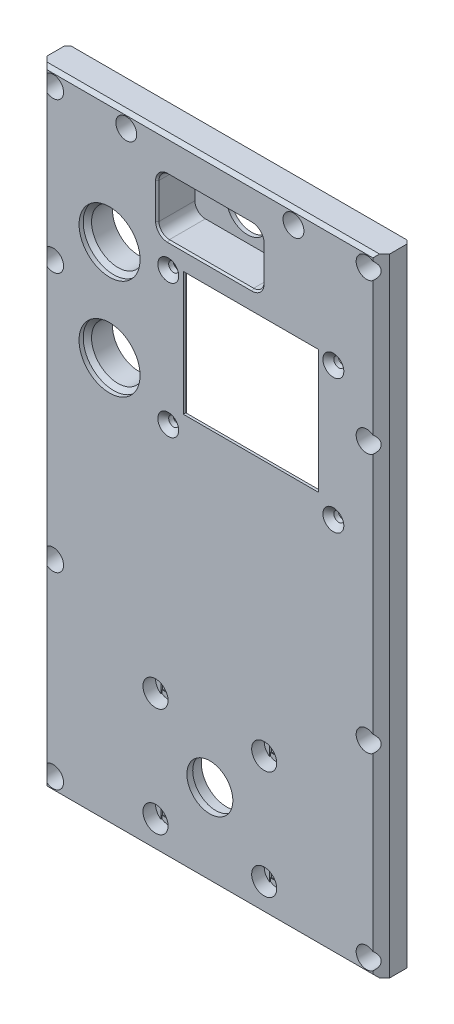
from build123d import *

# Parameters (mm, degrees)
SKETCH1_W                       = 82
SKETCH1_H                       = 150
SKETCH1_W_2                     = 68
SKETCH1_H_2                     = 136
BOSS_EXTRUDE1_DEPTH             = 7
SKETCH2_W                       = 68
SKETCH2_H                       = 36
BOSS_EXTRUDE2_DEPTH             = 7
SKETCH3_R                       = 5.5
CUT_EXTRUDE1_DEPTH              = 86.761296632
SKETCH4_R                       = 6.05
CUT_EXTRUDE2_DEPTH              = 5.6
SKETCH5_R                       = 11.1
CUT_EXTRUDE3_DEPTH              = 3
SKETCH6_R                       = 1.7
CUT_EXTRUDE4_DEPTH              = 86.761296632
SKETCH7_W                       = 50
SKETCH7_H                       = 38
CUT_EXTRUDE5_DEPTH              = 1
SKETCH8_R                       = 3
CUT_EXTRUDE6_DEPTH              = 3
SKETCH9_R                       = 1.45
CUT_EXTRUDE7_DEPTH              = 86.761296632
SKETCH10_R                      = 2.5
CUT_EXTRUDE8_DEPTH              = 5
CHAMFER1_SIZE                   = 2
SKETCH11_W                      = 68
SKETCH11_H                      = 30.5
BOSS_EXTRUDE3_DEPTH             = 7
CUT_EXTRUDE9_DEPTH              = 0.2
SKETCH13_W                      = 2.9
SKETCH13_H                      = 2.9
CUT_EXTRUDE10_DEPTH             = 0.2
CUT_EXTRUDE11_DEPTH             = 0.2
SKETCH15_W                      = 3.4
SKETCH15_H                      = 3.4
CUT_EXTRUDE12_DEPTH             = 0.2
CHAMFER3_SIZE                   = 0.8
SKETCH16_W                      = 2
SKETCH16_H                      = 4
BOSS_EXTRUDE4_DEPTH             = 1
LPATTERN1_COUNT                 = 2
LPATTERN1_PITCH                 = 20
LPATTERN1_COL_COUNT             = 2
LPATTERN1_COL_PITCH             = 20
SKETCH17_R                      = 1.45
CUT_EXTRUDE13_DEPTH             = 86.761296632
SKETCH18_R                      = 2.5
CUT_EXTRUDE14_DEPTH             = 5
CUT_EXTRUDE15_DEPTH             = 0.2
SKETCH20_W                      = 2.9
SKETCH20_H                      = 2.9
CUT_EXTRUDE16_DEPTH             = 0.2
SKIZZE4_W                       = 42
SKIZZE4_H                       = 26.8
SCHNITT_LINEAR_AUSTRAGEN1_DEPTH = 3.2
SKETCH38_W                      = 68
SKETCH38_H                      = 56
BOSS_EXTRUDE12_DEPTH            = 7
SKETCH41_W                      = 68
SKETCH41_H                      = 13.5
BOSS_EXTRUDE13_DEPTH            = 7
SKETCH44_R                      = 6.3
CUT_EXTRUDE19_DEPTH             = 86.761296632
SKETCH49_W                      = 25.15
SKETCH49_H                      = 13.5
CUT_EXTRUDE20_DEPTH             = 86.761296632
SKETCH50_W                      = 29.15
SKETCH50_H                      = 17.5
SKETCH50_W_2                    = 25.15
SKETCH50_H_2                    = 13.5
BOSS_EXTRUDE16_DEPTH            = 2
SKETCH51_W                      = 29.15
SKETCH51_H                      = 17.5
BOSS_EXTRUDE17_DEPTH            = 1
CUT_EXTRUDE21_DEPTH             = 87.058119896
CUT_EXTRUDE21_DEPTH_BACK        = 87.058119896
SKETCH52_R                      = 5
SKETCH53_W                      = 8.4
SKETCH53_H                      = 5
CUT_EXTRUDE22_DEPTH             = 6
SKETCH54_R                      = 7.3
CUT_EXTRUDE23_DEPTH             = 1
CHAMFER4_SIZE                   = 1
FILLET1_R                       = 2.5
CHAMFER5_SIZE                   = 0.4
SKETCH56_W                      = 45.7
SKETCH56_H                      = 38.2
CUT_EXTRUDE24_DEPTH             = 6.4
SKETCH57_W                      = 32.3
SKETCH57_H                      = 29.6
CUT_EXTRUDE25_DEPTH             = 86.990464588
SKETCH58_W                      = 5.1
SKETCH58_H                      = 38.2
BOSS_EXTRUDE18_DEPTH            = 1.8
SKETCH59_R                      = 1.2
CUT_EXTRUDE26_DEPTH             = 86.812353423
CHAMFER6_SIZE                   = 1.3


# Some blends are built 0.0001 mm under size
with BuildPart() as part:
    # Sketch1 → Boss-Extrude1 (new body)
    with BuildSketch(Plane.XY):
        Rectangle(SKETCH1_W, SKETCH1_H)
        Rectangle(SKETCH1_W_2, SKETCH1_H_2, mode=Mode.SUBTRACT)
    extrude(amount=BOSS_EXTRUDE1_DEPTH)

    # Sketch2 → Boss-Extrude2 (add)
    with BuildSketch(Plane.XY.offset(7)):
        with Locations((0, -50)):
            Rectangle(SKETCH2_W, SKETCH2_H)
    extrude(amount=-BOSS_EXTRUDE2_DEPTH)

    # Sketch3 → Cut-Extrude1 (cut, through all)
    with BuildSketch(Plane(origin=(0, 0, 0), x_dir=(-1, 0, 0), z_dir=(0, 0, -1))):
        with Locations((0, -55)):
            Circle(SKETCH3_R)
    extrude(amount=-CUT_EXTRUDE1_DEPTH, mode=Mode.SUBTRACT)

    # Sketch4 → Cut-Extrude2 (cut)
    with BuildSketch(Plane(origin=(0, 0, 0), x_dir=(-1, 0, 0), z_dir=(0, 0, -1))):
        with Locations((0, -55)):
            Circle(SKETCH4_R)
    extrude(amount=-CUT_EXTRUDE2_DEPTH, mode=Mode.SUBTRACT)

    # Sketch5 → Cut-Extrude3 (cut)
    with BuildSketch(Plane(origin=(0, 0, 0), x_dir=(-1, 0, 0), z_dir=(0, 0, -1))):
        with Locations((0, -55)):
            Circle(SKETCH5_R)
    extrude(amount=-CUT_EXTRUDE3_DEPTH, mode=Mode.SUBTRACT)

    # Sketch6 → Cut-Extrude4 (cut, through all)
    with BuildSketch(Plane(origin=(0, 0, 0), x_dir=(-1, 0, 0), z_dir=(0, 0, -1))):
        with Locations((-13, -42)):
            Circle(SKETCH6_R)
        with Locations((13, -42)):
            Circle(SKETCH6_R)
        with Locations((13, -68)):
            Circle(SKETCH6_R)
        with Locations((-13, -68)):
            Circle(SKETCH6_R)
    extrude(amount=-CUT_EXTRUDE4_DEPTH, mode=Mode.SUBTRACT)

    # Sketch7 → Cut-Extrude5 (cut)
    with BuildSketch(Plane(origin=(0, 0, 0), x_dir=(-1, 0, 0), z_dir=(0, 0, -1))):
        with Locations((0, -55)):
            Rectangle(SKETCH7_W, SKETCH7_H)
    extrude(amount=-CUT_EXTRUDE5_DEPTH, mode=Mode.SUBTRACT)

    # Sketch8 → Cut-Extrude6 (cut)
    with BuildSketch(Plane.XY.offset(7)):
        with Locations((-13, -42)):
            Circle(SKETCH8_R)
        with Locations((13, -42)):
            Circle(SKETCH8_R)
        with Locations((13, -68)):
            Circle(SKETCH8_R)
        with Locations((-13, -68)):
            Circle(SKETCH8_R)
    extrude(amount=-CUT_EXTRUDE6_DEPTH, mode=Mode.SUBTRACT)

    # Sketch9 → Cut-Extrude7 (cut, through all)
    with BuildSketch(Plane.XY.offset(7)):
        with Locations((-37.5, 71.5)):
            Circle(SKETCH9_R)
        with Locations((37.5, 71.5)):
            Circle(SKETCH9_R)
        with Locations((37.5, -71.5)):
            Circle(SKETCH9_R)
        with Locations((-37.5, -71.5)):
            Circle(SKETCH9_R)
        with Locations((-37.5, 35.5)):
            Circle(SKETCH9_R)
        with Locations((-37.5, -26.5)):
            Circle(SKETCH9_R)
        with Locations((37.5, -26.5)):
            Circle(SKETCH9_R)
        with Locations((37.5, 35.5)):
            Circle(SKETCH9_R)
    extrude(amount=-CUT_EXTRUDE7_DEPTH, mode=Mode.SUBTRACT)

    # Sketch10 → Cut-Extrude8 (cut)
    with BuildSketch(Plane.XY.offset(7)):
        with Locations((-37.5, 71.5)):
            Circle(SKETCH10_R)
        with Locations((37.5, 71.5)):
            Circle(SKETCH10_R)
        with Locations((-37.5, 35.5)):
            Circle(SKETCH10_R)
        with Locations((-37.5, -26.5)):
            Circle(SKETCH10_R)
        with Locations((-37.5, -71.5)):
            Circle(SKETCH10_R)
        with Locations((37.5, -71.5)):
            Circle(SKETCH10_R)
        with Locations((37.5, 35.5)):
            Circle(SKETCH10_R)
        with Locations((37.5, -26.5)):
            Circle(SKETCH10_R)
    extrude(amount=-CUT_EXTRUDE8_DEPTH, mode=Mode.SUBTRACT)

    # Chamfer1
    # the kernel refuses this chamfer: 2 mm, written as the material it takes off along each edge
    with BuildSketch(Plane(origin=(-41, 80.143365976, 7), x_dir=(-0.027495876610585623, 0, -0.9996219169112968), z_dir=(0, -1, 0)), Plane(origin=(41, -80.143365976, 7), x_dir=(0.027495876610585623, 0, -0.9996219169112968), z_dir=(0, 1, 0))) as chamfer1_piece_1:
        Polygon((CHAMFER1_SIZE * 0.999621916911, CHAMFER1_SIZE * 0.0274958766106), (-CHAMFER1_SIZE * 0.0274958766106, CHAMFER1_SIZE * 0.999621916911), (0, 0), align=None)
    extrude(amount=160.286731952, mode=Mode.SUBTRACT)

    # Sketch11 → Boss-Extrude3 (add)
    with BuildSketch(Plane.XY.offset(7)):
        with Locations((0, -16.75)):
            Rectangle(SKETCH11_W, SKETCH11_H)
    extrude(amount=-BOSS_EXTRUDE3_DEPTH)

    # Sketch12 → Cut-Extrude9 (cut)
    with BuildSketch(Plane.XY.offset(2)):
        with BuildLine():
            Line((-38.95, -73.536541185), (-38.95, -69.463458815))
            ThreePointArc((-38.95, -69.463458815), (-37.5, -69), (-36.05, -69.463458815))
            Line((-36.05, -69.463458815), (-36.05, -73.536541185))
            ThreePointArc((-36.05, -73.536541185), (-37.5, -74), (-38.95, -73.536541185))
        make_face()
        with BuildLine():
            Line((-38.95, -28.536541185), (-38.95, -24.463458815))
            ThreePointArc((-38.95, -24.463458815), (-37.5, -24), (-36.05, -24.463458815))
            Line((-36.05, -24.463458815), (-36.05, -28.536541185))
            ThreePointArc((-36.05, -28.536541185), (-37.5, -29), (-38.95, -28.536541185))
        make_face()
        with BuildLine():
            Line((-38.95, 33.463458815), (-38.95, 37.536541185))
            ThreePointArc((-38.95, 37.536541185), (-37.5, 38), (-36.05, 37.536541185))
            Line((-36.05, 37.536541185), (-36.05, 33.463458815))
            ThreePointArc((-36.05, 33.463458815), (-37.5, 33), (-38.95, 33.463458815))
        make_face()
        with BuildLine():
            Line((-38.95, 69.463458815), (-38.95, 73.536541185))
            ThreePointArc((-38.95, 73.536541185), (-37.5, 74), (-36.05, 73.536541185))
            Line((-36.05, 73.536541185), (-36.05, 69.463458815))
            ThreePointArc((-36.05, 69.463458815), (-37.5, 69), (-38.95, 69.463458815))
        make_face()
    cut_extrude9 = extrude(amount=-CUT_EXTRUDE9_DEPTH, mode=Mode.SUBTRACT)

    # Sketch13 → Cut-Extrude10 (cut)
    with BuildSketch(Plane.XY.offset(1.8)):
        with Locations((-37.5, -71.5)):
            Rectangle(SKETCH13_W, SKETCH13_H)
        with Locations((-37.5, -26.5)):
            Rectangle(SKETCH13_W, SKETCH13_H)
        with Locations((-37.5, 35.5)):
            Rectangle(SKETCH13_W, SKETCH13_H)
        with Locations((-37.5, 71.5)):
            Rectangle(SKETCH13_W, SKETCH13_H)
    cut_extrude10 = extrude(amount=-CUT_EXTRUDE10_DEPTH, mode=Mode.SUBTRACT)

    # Sketch14 → Cut-Extrude11 (cut)
    with BuildSketch(Plane.XY.offset(4)):
        with BuildLine():
            Line((-14.7, -44.471841419), (-14.7, -39.528158581))
            ThreePointArc((-14.7, -39.528158581), (-13, -39), (-11.3, -39.528158581))
            Line((-11.3, -39.528158581), (-11.3, -44.471841419))
            ThreePointArc((-11.3, -44.471841419), (-13, -45), (-14.7, -44.471841419))
        make_face()
        with BuildLine():
            Line((-14.7, -70.471841419), (-14.7, -65.528158581))
            ThreePointArc((-14.7, -65.528158581), (-13, -65), (-11.3, -65.528158581))
            Line((-11.3, -65.528158581), (-11.3, -70.471841419))
            ThreePointArc((-11.3, -70.471841419), (-13, -71), (-14.7, -70.471841419))
        make_face()
    cut_extrude11 = extrude(amount=-CUT_EXTRUDE11_DEPTH, mode=Mode.SUBTRACT)

    # Sketch15 → Cut-Extrude12 (cut)
    with BuildSketch(Plane.XY.offset(3.8)):
        with Locations((-13, -42)):
            Rectangle(SKETCH15_W, SKETCH15_H)
        with Locations((-13, -68)):
            Rectangle(SKETCH15_W, SKETCH15_H)
    cut_extrude12 = extrude(amount=-CUT_EXTRUDE12_DEPTH, mode=Mode.SUBTRACT)

    # Mirror1: Cut-Extrude9, Cut-Extrude10, Cut-Extrude11, Cut-Extrude12 across plane
    add(cut_extrude9.mirror(Plane(origin=(0, 0, 0), x_dir=(0, 0, 1), z_dir=(1, 0, 0))), mode=Mode.SUBTRACT)
    add(cut_extrude10.mirror(Plane(origin=(0, 0, 0), x_dir=(0, 0, 1), z_dir=(1, 0, 0))), mode=Mode.SUBTRACT)
    add(cut_extrude11.mirror(Plane(origin=(0, 0, 0), x_dir=(0, 0, 1), z_dir=(1, 0, 0))), mode=Mode.SUBTRACT)
    add(cut_extrude12.mirror(Plane(origin=(0, 0, 0), x_dir=(0, 0, 1), z_dir=(1, 0, 0))), mode=Mode.SUBTRACT)

    # Chamfer3
    chamfer3_edges = [part.edges().sort_by_distance(p)[0] for p in [
        (0, 75, 7),
        (0, -75, 7),
        (-41, 0, 0),
        (41, 0, 0),
    ]]
    chamfer(chamfer3_edges, length=CHAMFER3_SIZE)

    # Sketch16 → Boss-Extrude4 (add, symmetric)
    # profile 1 of 2: a face of its own
    with BuildSketch(Plane(origin=(0, 0, 0), x_dir=(0, 0, -1), z_dir=(1, 0, 0))):
        Polygon((0, -4), (0, -15.4), (3.2, -12.2), (3.2, -7.2), align=None)
        with Locations((1.6, -9.7)):
            Rectangle(SKETCH16_W, SKETCH16_H, mode=Mode.SUBTRACT)
    # profile 2 of 2: a face of its own
    with BuildSketch(Plane(origin=(0, 0, 0), x_dir=(0, 0, -1), z_dir=(1, 0, 0))):
        Polygon((3.2, -27.6), (0, -30.8), (0, -19.4), (3.2, -22.6), align=None)
        with Locations((1.6, -25.1)):
            Rectangle(SKETCH16_W, SKETCH16_H, mode=Mode.SUBTRACT)
    boss_extrude4 = extrude(amount=BOSS_EXTRUDE4_DEPTH, both=True)

    # LPattern1: Boss-Extrude4 ×2
    with Locations(*[(i * LPATTERN1_PITCH, 0, 0) for i in range(1, LPATTERN1_COUNT)]):
        add(boss_extrude4)

    # LPattern1 col: Boss-Extrude4 ×2
    with Locations(*[(-i * LPATTERN1_COL_PITCH, 0, 0) for i in range(1, LPATTERN1_COL_COUNT)]):
        add(boss_extrude4)

    # Sketch17 → Cut-Extrude13 (cut, through all)
    with BuildSketch(Plane(origin=(0, 0, 0), x_dir=(-1, 0, 0), z_dir=(0, 0, -1))):
        with Locations((-20, 71.5)):
            Circle(SKETCH17_R)
        with Locations((20, 71.5)):
            Circle(SKETCH17_R)
    extrude(amount=-CUT_EXTRUDE13_DEPTH, mode=Mode.SUBTRACT)

    # Sketch18 → Cut-Extrude14 (cut)
    with BuildSketch(Plane.XY.offset(7)):
        with Locations((-20, 71.5)):
            Circle(SKETCH18_R)
        with Locations((20, 71.5)):
            Circle(SKETCH18_R)
    extrude(amount=-CUT_EXTRUDE14_DEPTH, mode=Mode.SUBTRACT)

    # Sketch19 → Cut-Extrude15 (cut)
    with BuildSketch(Plane.XY.offset(2)):
        with BuildLine():
            Line((-21.45, 69.463458815), (-21.45, 73.536541185))
            ThreePointArc((-21.45, 73.536541185), (-20, 74), (-18.55, 73.536541185))
            Line((-18.55, 73.536541185), (-18.55, 69.463458815))
            ThreePointArc((-18.55, 69.463458815), (-20, 69), (-21.45, 69.463458815))
        make_face()
        with BuildLine():
            Line((18.55, 69.463458815), (18.55, 73.536541185))
            ThreePointArc((18.55, 73.536541185), (20, 74), (21.45, 73.536541185))
            Line((21.45, 73.536541185), (21.45, 69.463458815))
            ThreePointArc((21.45, 69.463458815), (20, 69), (18.55, 69.463458815))
        make_face()
    extrude(amount=-CUT_EXTRUDE15_DEPTH, mode=Mode.SUBTRACT)

    # Sketch20 → Cut-Extrude16 (cut)
    with BuildSketch(Plane.XY.offset(1.8)):
        with Locations((-20, 71.5)):
            Rectangle(SKETCH20_W, SKETCH20_H)
        with Locations((20, 71.5)):
            Rectangle(SKETCH20_W, SKETCH20_H)
    extrude(amount=-CUT_EXTRUDE16_DEPTH, mode=Mode.SUBTRACT)

    # Skizze4 → Schnitt-Linear austragen1 (cut)
    with BuildSketch(Plane(origin=(0, 0, 0), x_dir=(-1, 0, 0), z_dir=(0, 0, -1))):
        with Locations((0, -17.4)):
            Rectangle(SKIZZE4_W, SKIZZE4_H)
    extrude(amount=SCHNITT_LINEAR_AUSTRAGEN1_DEPTH, mode=Mode.SUBTRACT)

    # Sketch38 → Boss-Extrude12 (add)
    with BuildSketch(Plane.XY.offset(7)):
        with Locations((0, 40)):
            Rectangle(SKETCH38_W, SKETCH38_H)
    extrude(amount=-BOSS_EXTRUDE12_DEPTH)

    # Sketch41 → Boss-Extrude13 (add)
    with BuildSketch(Plane.XY.offset(7)):
        with Locations((0, 5.25)):
            Rectangle(SKETCH41_W, SKETCH41_H)
    extrude(amount=-BOSS_EXTRUDE13_DEPTH)

    # Sketch44 → Cut-Extrude19 (cut, through all)
    with BuildSketch(Plane(origin=(0, 0, 0), x_dir=(-1, 0, 0), z_dir=(0, 0, -1))):
        with Locations((24, 22)):
            Circle(SKETCH44_R)
        with Locations((24, 46)):
            Circle(SKETCH44_R)
    extrude(amount=-CUT_EXTRUDE19_DEPTH, mode=Mode.SUBTRACT)

    # Sketch49 → Cut-Extrude20 (cut, through all)
    with BuildSketch(Plane.XY.offset(7)):
        with Locations((0, 60)):
            Rectangle(SKETCH49_W, SKETCH49_H)
    extrude(amount=-CUT_EXTRUDE20_DEPTH, mode=Mode.SUBTRACT)

    # Sketch50 → Boss-Extrude16 (add)
    with BuildSketch(Plane(origin=(0, 0, 0), x_dir=(-1, 0, 0), z_dir=(0, 0, -1))):
        with Locations((0, 60)):
            Rectangle(SKETCH50_W, SKETCH50_H)
        with Locations((0, 60)):
            Rectangle(SKETCH50_W_2, SKETCH50_H_2, mode=Mode.SUBTRACT)
    extrude(amount=BOSS_EXTRUDE16_DEPTH)

    # Sketch51 → Boss-Extrude17 (add)
    with BuildSketch(Plane(origin=(0, 0, -2), x_dir=(-1, 0, 0), z_dir=(0, 0, -1))):
        with Locations((0, 60)):
            Rectangle(SKETCH51_W, SKETCH51_H)
    extrude(amount=BOSS_EXTRUDE17_DEPTH)

    # Sketch52 → Cut-Extrude21 (cut, two sides: drawn at the far end of the back side and taken through both)
    with BuildSketch(Plane(origin=(0, 0, -3), x_dir=(-1, 0, 0), z_dir=(0, 0, -1)).offset(-CUT_EXTRUDE21_DEPTH_BACK)):
        with Locations((0, 60)):
            Circle(SKETCH52_R)
    extrude(amount=CUT_EXTRUDE21_DEPTH + CUT_EXTRUDE21_DEPTH_BACK, mode=Mode.SUBTRACT)

    # Sketch53 → Cut-Extrude22 (cut)
    with BuildSketch(Plane.ZY.offset(-12.575)):
        with Locations((2.2, 60)):
            Rectangle(SKETCH53_W, SKETCH53_H)
    extrude(amount=-CUT_EXTRUDE22_DEPTH, mode=Mode.SUBTRACT)

    # Sketch54 → Cut-Extrude23 (cut)
    with BuildSketch(Plane.XY.offset(7)):
        with Locations((-24, 46)):
            Circle(SKETCH54_R)
        with Locations((-24, 22)):
            Circle(SKETCH54_R)
    extrude(amount=-CUT_EXTRUDE23_DEPTH, mode=Mode.SUBTRACT)

    # Chamfer4
    chamfer4_edges = [part.edges().sort_by_distance(p)[0] for p in [
        (-17.7, 46, 6),
        (-17.7, 22, 6),
    ]]
    chamfer(chamfer4_edges, length=CHAMFER4_SIZE - 0.0001)  # a hair under: the kernel refuses the full size

    # Fillet1
    fillet1_edges = [part.edges().sort_by_distance(p)[0] for p in [
        (12.575, 66.75, 3.5),
        (12.575, 53.25, 3.5),
        (-12.575, 53.25, 3.5),
        (-12.575, 66.75, 3.5),
    ]]
    fillet(fillet1_edges, radius=FILLET1_R)

    # Chamfer5
    chamfer5_edges = [part.edges().sort_by_distance(p)[0] for p in [
        (12.575, 60, 7),
        (0, 53.25, 7),
        (-12.575, 60, 7),
        (0, 66.75, 7),
        (11.842766953, 53.982233047, 7),
        (-11.842766953, 53.982233047, 7),
        (11.842766953, 66.017766953, 7),
        (-11.842766953, 66.017766953, 7),
    ]]
    chamfer(chamfer5_edges, length=CHAMFER5_SIZE)

    # Sketch56 → Cut-Extrude24 (cut)
    with BuildSketch(Plane(origin=(0, 0, 0), x_dir=(-1, 0, 0), z_dir=(0, 0, -1))):
        with Locations((-9.8, 31.225)):
            Rectangle(SKETCH56_W, SKETCH56_H)
    extrude(amount=-CUT_EXTRUDE24_DEPTH, mode=Mode.SUBTRACT)

    # Sketch57 → Cut-Extrude25 (cut, through all)
    with BuildSketch(Plane(origin=(0, 0, 6.4), x_dir=(-1, 0, 0), z_dir=(0, 0, -1))):
        with Locations((-9.8, 33.925)):
            Rectangle(SKETCH57_W, SKETCH57_H)
    extrude(amount=-CUT_EXTRUDE25_DEPTH, mode=Mode.SUBTRACT)

    # Sketch58 → Boss-Extrude18 (add)
    with BuildSketch(Plane(origin=(0, 0, 6.4), x_dir=(-1, 0, 0), z_dir=(0, 0, -1))):
        with Locations((-30.1, 31.225)):
            Rectangle(SKETCH58_W, SKETCH58_H)
        with Locations((10.5, 31.225)):
            Rectangle(SKETCH58_W, SKETCH58_H)
    extrude(amount=BOSS_EXTRUDE18_DEPTH)

    # Sketch59 → Cut-Extrude26 (cut, through all)
    with BuildSketch(Plane(origin=(0, 0, 4.6), x_dir=(-1, 0, 0), z_dir=(0, 0, -1))):
        with Locations((-29.55, 47.225)):
            Circle(SKETCH59_R)
        with Locations((9.95, 47.225)):
            Circle(SKETCH59_R)
        with Locations((9.95, 15.225)):
            Circle(SKETCH59_R)
        with Locations((-29.55, 15.225)):
            Circle(SKETCH59_R)
    extrude(amount=-CUT_EXTRUDE26_DEPTH, mode=Mode.SUBTRACT)

    # Chamfer6
    chamfer6_edges = [part.edges().sort_by_distance(p)[0] for p in [
        (30.75, 15.225, 7),
        (-8.75, 15.225, 7),
        (-8.75, 47.225, 7),
        (30.75, 47.225, 7),
    ]]
    chamfer(chamfer6_edges, length=CHAMFER6_SIZE)


solid = part.part
